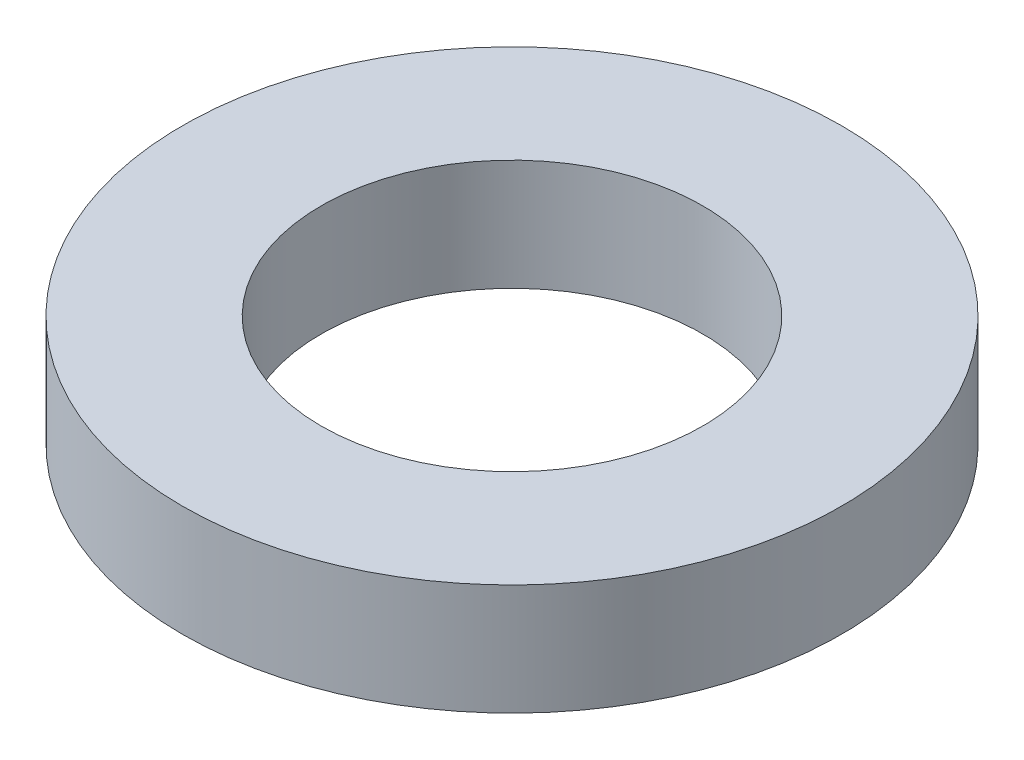
from build123d import *

# Parameters (mm, degrees)
SKETCH1_R           = 47.5
BOSS_EXTRUDE1_DEPTH = 16
SKETCH2_R           = 27.5
CUT_EXTRUDE1_DEPTH  = 70.054326439


with BuildPart() as part:
    # Sketch1 → Boss-Extrude1 (new body)
    with BuildSketch(Plane(origin=(0, 0, 0), x_dir=(1, 0, 0), z_dir=(0, 1, 0))):
        Circle(SKETCH1_R)
    extrude(amount=BOSS_EXTRUDE1_DEPTH)

    # Sketch2 → Cut-Extrude1 (cut, through all)
    with BuildSketch(Plane(origin=(0, 0, 0), x_dir=(1, 0, 0), z_dir=(0, 1, 0))):
        Circle(SKETCH2_R)
    extrude(amount=CUT_EXTRUDE1_DEPTH, mode=Mode.SUBTRACT)


solid = part.part
